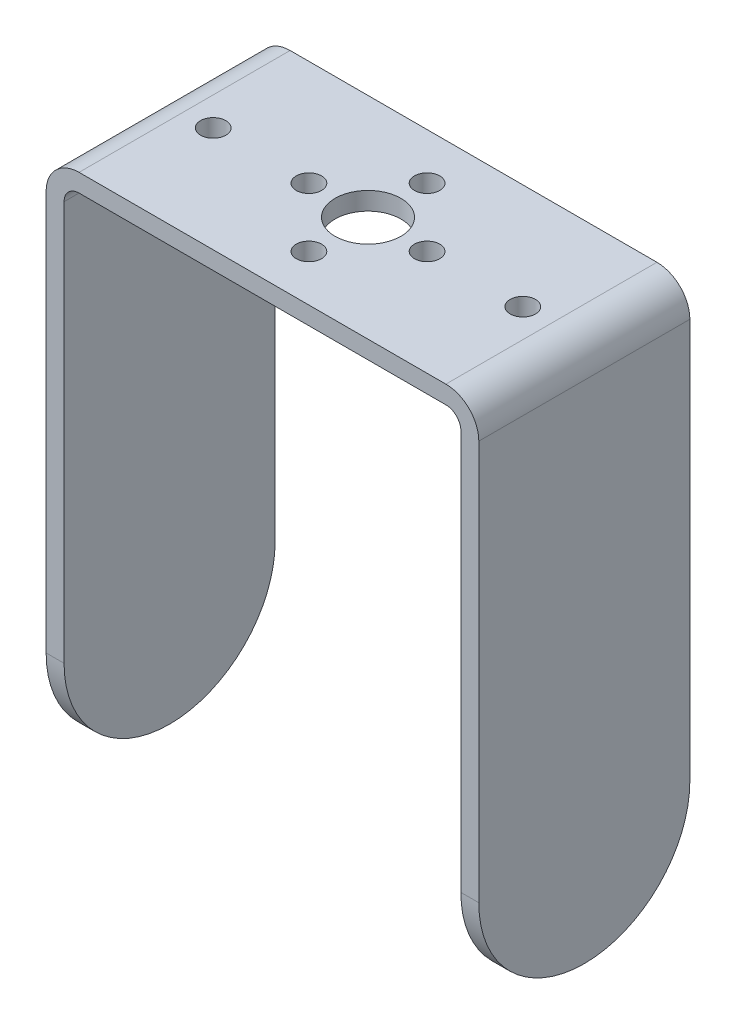
from build123d import *

# Parameters (mm, degrees)
EXTRUDE_THIN1_DEPTH        = 12.7
FILLET1_R                  = 12.7
SKETCH2_R                  = 3.9624
CUT_EXTRUDE1_DEPTH         = 71.952548404
F_31_0_12_DIAMETER_HOLE1_D = 3.048


with BuildPart() as part:
    # Sketch1 → Extrude-Thin1 (new, symmetric)
    with BuildSketch(Plane.XY):
        with BuildLine():
            Line((-26.035, -64.77), (-26.035, -3.9624))
            ThreePointArc((-26.035, -3.9624), (-24.87443991, -1.16056009), (-22.0726, 0))
            Line((-22.0726, 0), (22.0726, 0))
            ThreePointArc((22.0726, 0), (24.87443991, -1.16056009), (26.035, -3.9624))
            Line((26.035, -3.9624), (26.035, -64.77))
            Line((26.035, -64.77), (23.876, -64.77))
            Line((23.876, -64.77), (23.876, -3.9624))
            ThreePointArc((23.876, -3.9624), (23.347796369, -2.687203631), (22.0726, -2.159))
            Line((22.0726, -2.159), (-22.0726, -2.159))
            ThreePointArc((-22.0726, -2.159), (-23.347796369, -2.687203631), (-23.876, -3.9624))
            Line((-23.876, -3.9624), (-23.876, -64.77))
            Line((-23.876, -64.77), (-26.035, -64.77))
        make_face()
    extrude(amount=EXTRUDE_THIN1_DEPTH, both=True)

    # Fillet1
    fillet1_edges = [part.edges().sort_by_distance(p)[0] for p in [
        (24.9555, -64.77, -12.7),
        (24.9555, -64.77, 12.7),
        (-24.9555, -64.77, -12.7),
        (-24.9555, -64.77, 12.7),
    ]]
    fillet(fillet1_edges, radius=FILLET1_R - 0.0001)  # a hair under: the kernel refuses the full size

    # Sketch2 → Cut-Extrude1 (cut, through all)
    with BuildSketch(Plane(origin=(0, 0, 0), x_dir=(1, 0, 0), z_dir=(0, 1, 0))):
        with Locations(Location((0, 0, 0), (0, 0, 270))):
            Circle(SKETCH2_R)
    extrude(amount=-CUT_EXTRUDE1_DEPTH, mode=Mode.SUBTRACT)

    # #31 (0.12) Diameter Hole1 (through all)
    with Locations(Plane(origin=(0, 0, 0), x_dir=(1, 0, 0), z_dir=(0, 1, 0))):
        with Locations((0, -7.112), (0, 7.112), (-7.112, 0), (7.112, 0), (18.6309, 0), (-18.6309, 0)):
            Hole(F_31_0_12_DIAMETER_HOLE1_D / 2)


solid = part.part
